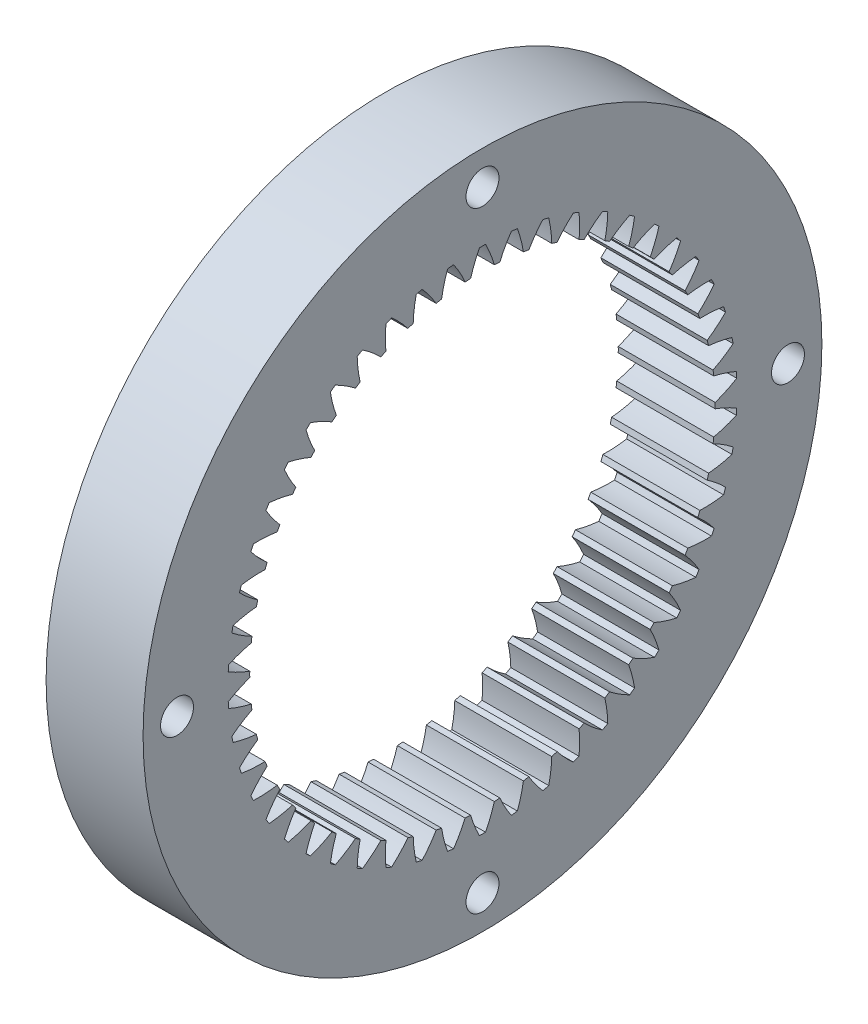
from build123d import *

# Parameters (mm, degrees)
BASPROSKE_W           = 10
BASPROSKE_H           = 11
TOOTHCUT_DEPTH        = 51.497524692
TEETHCUTS_COUNT       = 50
TEETHCUTS_ANGLE       = 352.8
CROQUIS2_R            = 1.7
CORTAR_EXTRUIR1_DEPTH = 10


with BuildPart() as part:
    # BasProSke → Base-Revolve (revolve)
    with BuildSketch(Plane(origin=(0, 0, 0), x_dir=(1, 0, 0), z_dir=(0, 1, 0)), mode=Mode.PRIVATE) as base_revolve_sk:
        with Locations((5, 29.5)):
            Rectangle(BASPROSKE_W, BASPROSKE_H)
    revolve(base_revolve_sk.sketch.rotate(Axis((-10, 0, 0), (1, 0, 0)), 180), axis=Axis((-10, 0, 0), (1, 0, 0)))

    # TooCutSke → ToothCut (cut, through all)
    with BuildSketch(Plane(origin=(0, 0, 0), x_dir=(0, 0, -1), z_dir=(1, 0, 0))):
        with BuildLine():
            ThreePointArc((1.228249008, 23.943116955), (0.8277994, 25.118901547), (0.312635126, 26.249138277))
            ThreePointArc((0.312635126, 26.249138277), (0, 26.251), (-0.312635126, 26.249138277))
            ThreePointArc((-0.312635126, 26.249138277), (-0.8277994, 25.118901547), (-1.228249008, 23.943116955))
            ThreePointArc((-1.228249008, 23.943116955), (0, 23.9746), (1.228249008, 23.943116955))
        make_face()
    toothcut = extrude(amount=TOOTHCUT_DEPTH, mode=Mode.SUBTRACT)

    # TeethCuts: ToothCut ×50 about axis
    teethcuts_axis = Axis((-10, 0, 0), (1, 0, 0))
    for i in range(1, TEETHCUTS_COUNT):
        add(toothcut.rotate(teethcuts_axis, i * TEETHCUTS_ANGLE / (TEETHCUTS_COUNT - 1)), mode=Mode.SUBTRACT)

    # Croquis2 → Cortar-Extruir1 (cut)
    with BuildSketch(Plane.ZY):
        with Locations((31.5, 0)):
            Circle(CROQUIS2_R)
        with Locations((0, 31.5)):
            Circle(CROQUIS2_R)
        with Locations((0, -31.5)):
            Circle(CROQUIS2_R)
        with Locations((-31.5, 0)):
            Circle(CROQUIS2_R)
    extrude(amount=-CORTAR_EXTRUIR1_DEPTH, mode=Mode.SUBTRACT)


solid = part.part
